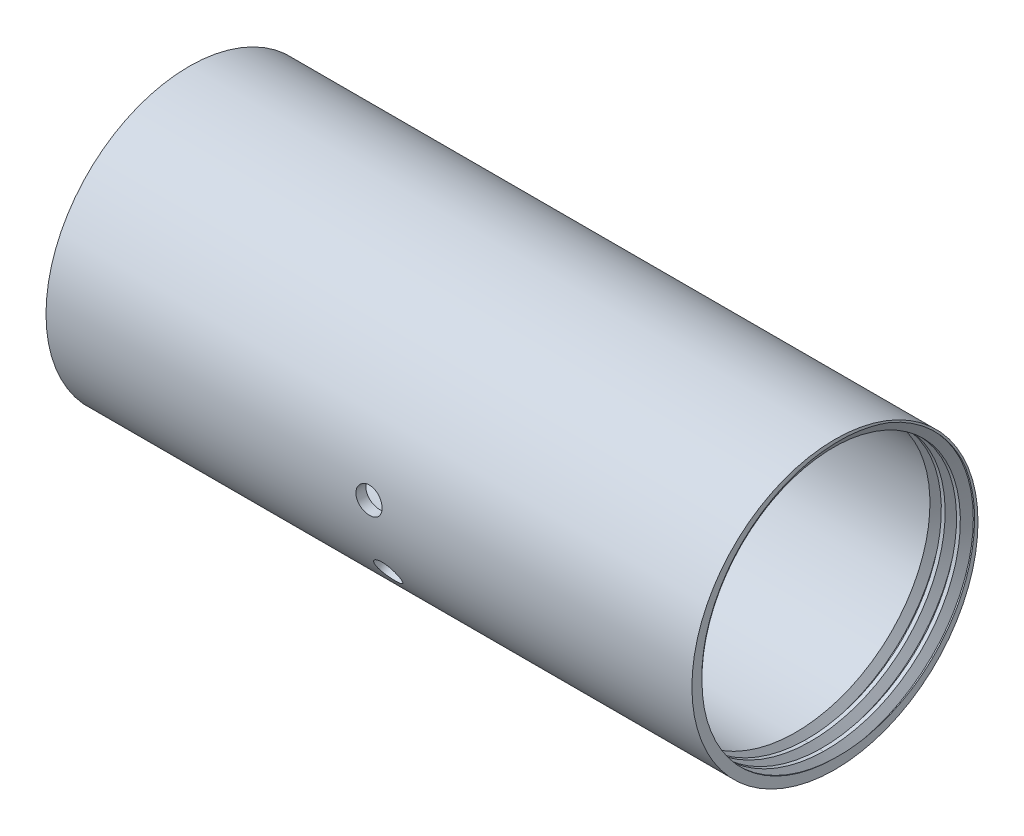
from build123d import *

# Parameters (mm, degrees)
SKETCH1_R               = 37.65
SKETCH1_R_2             = 35
BOSS_EXTRUDE1_DEPTH     = 85
THREAD2_PITCH           = 4
THREAD3_PITCH           = 4
CUT_EXTRUDE1_REACH      = 121.635
CUT_EXTRUDE1_END_RADIUS = 35
SKETCH2_R               = 3.45
CIRPATTERN1_COUNT       = 4
CIRPATTERN1_ANGLE       = 90


with BuildPart() as part:
    # Sketch1 → Boss-Extrude1 (new, symmetric)
    with BuildSketch(Plane(origin=(0, 0, 0), x_dir=(0, 0, -1), z_dir=(1, 0, 0))):
        Circle(SKETCH1_R)
        Circle(SKETCH1_R_2, mode=Mode.SUBTRACT)
    extrude(amount=BOSS_EXTRUDE1_DEPTH, both=True)

    # Thread2: the profile of Thread Profile2 profile screwed along a right-hand helix of 5 turns, 12 arcs to a turn; built about Z, then put on its axis
    thread2_z = Axis((0, 0, 0), (0, 0, 1))
    thread2_corners = [(34.9997, 0, -0.000173205), (37.1650635, 0, 1.249999995), (37.1650635, 0, 1.749999995), (34.9997, 0, 3.000173194)]
    with BuildLine(mode=Mode.PRIVATE) as thread2_profile:
        Line(thread2_corners[0], thread2_corners[1])
        Line(thread2_corners[1], thread2_corners[2])
        Line(thread2_corners[2], thread2_corners[3])
        Line(thread2_corners[3], thread2_corners[0])
    thread2_cap = Face(thread2_profile.wire())
    thread2_turn_angles = [0, 15, 30, 45, 60, 75, 90, 105, 120, 135, 150, 165, 180, 195, 210, 225, 240, 255, 270, 285, 300, 315, 330, 345, 360]
    thread2_turn_weights = [1, 0.9659258262890683, 1, 0.9659258262890683, 1, 0.9659258262890683, 1, 0.9659258262890683, 1, 0.9659258262890683, 1, 0.9659258262890683, 1, 0.9659258262890683, 1, 0.9659258262890683, 1, 0.9659258262890683, 1, 0.9659258262890683, 1, 0.9659258262890683, 1, 0.9659258262890683, 1]
    thread2_turn_rails = [Edge.make_bspline([Vector(p[0], p[1], 0).rotate(thread2_z, thread2_turn_angles[k]) / thread2_turn_weights[k] + Vector(0, 0, p[2] + THREAD2_PITCH * thread2_turn_angles[k] / 360) for k in range(25)], [0, 0, 0, 1, 1, 2, 2, 3, 3, 4, 4, 5, 5, 6, 6, 7, 7, 8, 8, 9, 9, 10, 10, 11, 11, 12, 12, 12], 2, thread2_turn_weights) for p in thread2_corners]
    thread2_turn_sides = [Face.make_surface_from_curves(thread2_turn_rails[p[0]], thread2_turn_rails[p[1]]) for p in [(0, 1), (1, 2), (2, 3), (3, 0)]]
    thread2 = Plane(origin=(96, 0, 0), x_dir=(0, 0, 1), z_dir=(-1, 0, 0)) * Solid(Shell([*[p.moved(Location((0, 0, THREAD2_PITCH * i))) for i in range(5) for p in thread2_turn_sides], thread2_cap, thread2_cap.rotate(thread2_z, 1800).moved(Location((0, 0, THREAD2_PITCH * 1800 / 360)))]))
    add(thread2, mode=Mode.SUBTRACT)

    # Thread3: the profile of Thread Profile3 profile screwed along a right-hand helix of 5 turns, 12 arcs to a turn; built about Z, then put on its axis
    thread3_z = Axis((0, 0, 0), (0, 0, 1))
    thread3_corners = [(34.9997, 0, -0.000173205), (37.1650635, 0, 1.249999995), (37.1650635, 0, 1.749999995), (34.9997, 0, 3.000173194)]
    with BuildLine(mode=Mode.PRIVATE) as thread3_profile:
        Line(thread3_corners[0], thread3_corners[1])
        Line(thread3_corners[1], thread3_corners[2])
        Line(thread3_corners[2], thread3_corners[3])
        Line(thread3_corners[3], thread3_corners[0])
    thread3_cap = Face(thread3_profile.wire())
    thread3_turn_angles = [0, 15, 30, 45, 60, 75, 90, 105, 120, 135, 150, 165, 180, 195, 210, 225, 240, 255, 270, 285, 300, 315, 330, 345, 360]
    thread3_turn_weights = [1, 0.9659258262890683, 1, 0.9659258262890683, 1, 0.9659258262890683, 1, 0.9659258262890683, 1, 0.9659258262890683, 1, 0.9659258262890683, 1, 0.9659258262890683, 1, 0.9659258262890683, 1, 0.9659258262890683, 1, 0.9659258262890683, 1, 0.9659258262890683, 1, 0.9659258262890683, 1]
    thread3_turn_rails = [Edge.make_bspline([Vector(p[0], p[1], 0).rotate(thread3_z, thread3_turn_angles[k]) / thread3_turn_weights[k] + Vector(0, 0, p[2] + THREAD3_PITCH * thread3_turn_angles[k] / 360) for k in range(25)], [0, 0, 0, 1, 1, 2, 2, 3, 3, 4, 4, 5, 5, 6, 6, 7, 7, 8, 8, 9, 9, 10, 10, 11, 11, 12, 12, 12], 2, thread3_turn_weights) for p in thread3_corners]
    thread3_turn_sides = [Face.make_surface_from_curves(thread3_turn_rails[p[0]], thread3_turn_rails[p[1]]) for p in [(0, 1), (1, 2), (2, 3), (3, 0)]]
    thread3 = Plane(origin=(-96, 0, 0), x_dir=(0, 0, -1), z_dir=(1, 0, 0)) * Solid(Shell([*[p.moved(Location((0, 0, THREAD3_PITCH * i))) for i in range(5) for p in thread3_turn_sides], thread3_cap, thread3_cap.rotate(thread3_z, 1800).moved(Location((0, 0, THREAD3_PITCH * 1800 / 360)))]))
    add(thread3, mode=Mode.SUBTRACT)

    # Cut-Extrude1: up to this cylinder (the profile starts outside it)
    cut_extrude1_end = Plane(origin=(0, 0, 0), z_dir=(-1, 0, 0)) * Cylinder(CUT_EXTRUDE1_END_RADIUS, 314.27, mode=Mode.PRIVATE)
    # Sketch2 → Cut-Extrude1 (cut, up to the surface)
    with BuildSketch(Plane(origin=(0, -37.65, 0), x_dir=(-1, 0, 0), z_dir=(0, -1, 0)), mode=Mode.PRIVATE) as cut_extrude1_sk1:
        with Locations(Location((0, 0, 0), (0, 0, 90))):
            Circle(SKETCH2_R)
    cut_extrude1_tool1 = extrude(cut_extrude1_sk1.sketch, amount=-CUT_EXTRUDE1_REACH, mode=Mode.PRIVATE) - cut_extrude1_end
    cut_extrude1 = cut_extrude1_tool1.solids().sort_by_distance((0, -37.65, 0))[0]
    add(cut_extrude1, mode=Mode.SUBTRACT)

    # CirPattern1: Cut-Extrude1 ×4 about axis
    cirpattern1_axis = Axis((85, 0, 0), (-1, 0, 0))
    for i in range(1, CIRPATTERN1_COUNT):
        add(cut_extrude1.rotate(cirpattern1_axis, i * CIRPATTERN1_ANGLE / (CIRPATTERN1_COUNT - 1)), mode=Mode.SUBTRACT)


solid = part.part
